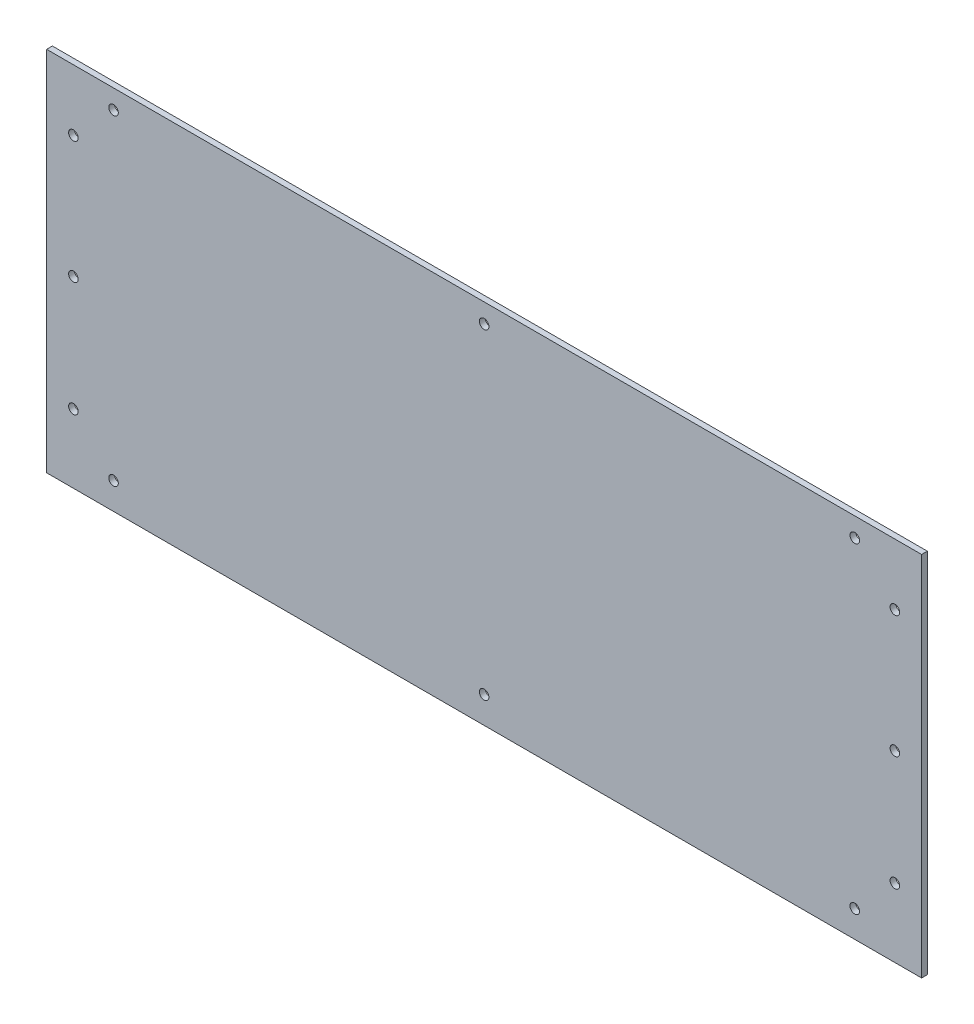
from build123d import *

# Parameters (mm, degrees)
SKETCH1_W           = 458
SKETCH1_H           = 192
BOSS_EXTRUDE1_DEPTH = 3
SKETCH2_R           = 2.5
CUT_EXTRUDE1_DEPTH  = 249.326398113


with BuildPart() as part:
    # Sketch1 → Boss-Extrude1 (new body)
    with BuildSketch(Plane.XY):
        Rectangle(SKETCH1_W, SKETCH1_H)
    extrude(amount=BOSS_EXTRUDE1_DEPTH)

    # Sketch2 → Cut-Extrude1 (cut, through all)
    with BuildSketch(Plane.XY.offset(3)):
        with Locations((-194, 86)):
            Circle(SKETCH2_R)
        with Locations((-194, -82.004592541)):
            Circle(SKETCH2_R)
        with Locations((194, -82.004592541)):
            Circle(SKETCH2_R)
        with Locations((194, 86)):
            Circle(SKETCH2_R)
        with Locations((-215, 0)):
            Circle(SKETCH2_R)
        with Locations((-215, -60)):
            Circle(SKETCH2_R)
        with Locations((-215, 64)):
            Circle(SKETCH2_R)
        with Locations((215, 0)):
            Circle(SKETCH2_R)
        with Locations((215, -60)):
            Circle(SKETCH2_R)
        with Locations((215, 64)):
            Circle(SKETCH2_R)
        with Locations((0, 86)):
            Circle(SKETCH2_R)
        with Locations((0, -82.004592541)):
            Circle(SKETCH2_R)
    extrude(amount=-CUT_EXTRUDE1_DEPTH, mode=Mode.SUBTRACT)


solid = part.part
